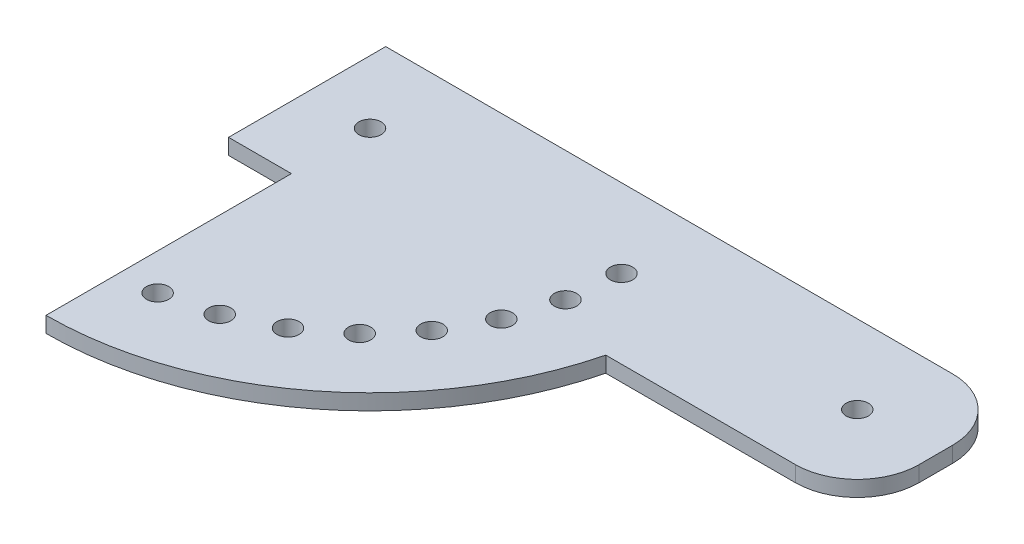
from build123d import *

# Parameters (mm, degrees)
SKETCH1_R           = 2.25
BOSS_EXTRUDE1_DEPTH = 3.175


with BuildPart() as part:
    # Sketch1 → Boss-Extrude1 (new body)
    with BuildSketch(Plane(origin=(0, 0, 0), x_dir=(1, 0, 0), z_dir=(0, 1, 0))):
        with BuildLine():
            Line((-12.7, -15.875), (-12.7, 15.875))
            Line((-12.7, 15.875), (101.8, 15.875))
            ThreePointArc((101.8, 15.875), (110.638834765, 12.213834765), (114.3, 3.375))
            Line((114.3, 3.375), (114.3, -3.375))
            ThreePointArc((114.3, -3.375), (110.638834765, -12.213834765), (101.8, -15.875))
            Line((101.8, -15.875), (63.5, -15.875))
            ThreePointArc((63.5, -15.875), (40.28137649, -51.591436626), (0, -65.454301807))
            Line((0, -65.454301807), (0, -15.875))
            Line((0, -15.875), (-12.7, -15.875))
        make_face()
        Circle(SKETCH1_R, mode=Mode.SUBTRACT)
        with Locations((98.425, 0)):
            Circle(SKETCH1_R, mode=Mode.SUBTRACT)
        with Locations((50.8, 0)):
            Circle(SKETCH1_R, mode=Mode.SUBTRACT)
        with Locations((49.750497609, -10.272681618)):
            Circle(SKETCH1_R, mode=Mode.SUBTRACT)
        with Locations((46.645354818, -20.120906389)):
            Circle(SKETCH1_R, mode=Mode.SUBTRACT)
        with Locations((41.612872995, -29.137755595)):
            Circle(SKETCH1_R, mode=Mode.SUBTRACT)
        with Locations((34.860989216, -36.950662117)):
            Circle(SKETCH1_R, mode=Mode.SUBTRACT)
        with Locations((26.66868451, -43.236804536)):
            Circle(SKETCH1_R, mode=Mode.SUBTRACT)
        with Locations((17.374456649, -47.736445785)):
            Circle(SKETCH1_R, mode=Mode.SUBTRACT)
        with Locations((7.362333757, -50.263665223)):
            Circle(SKETCH1_R, mode=Mode.SUBTRACT)
    extrude(amount=BOSS_EXTRUDE1_DEPTH)


solid = part.part
